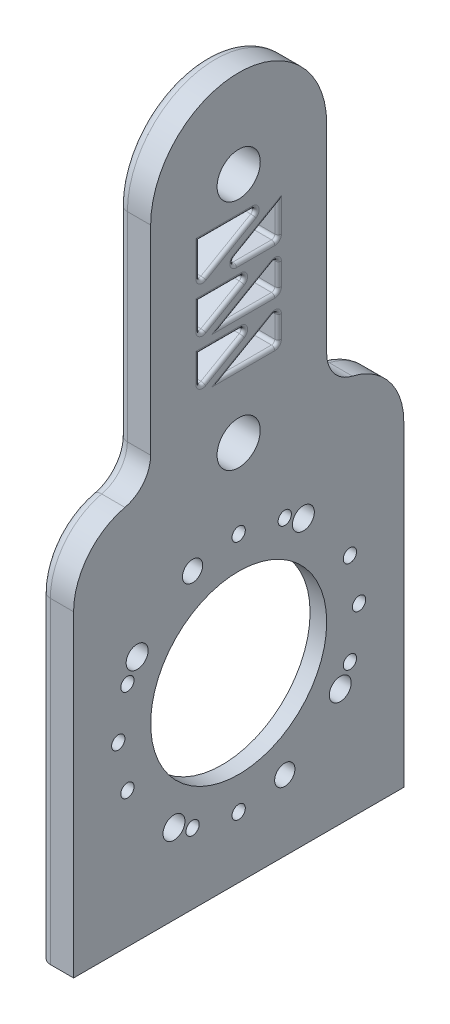
from build123d import *

# Parameters (mm, degrees)
SKETCH2_R           = 6.5
SKETCH2_R_2         = 2
SKETCH2_R_3         = 3.3
SKETCH2_R_4         = 3.05
SKETCH2_R_5         = 26.5
BOSS_EXTRUDE1_DEPTH = 5
BOSS_EXTRUDE2_START = -5
SKETCH2_5_R         = 6.5
SKETCH2_5_R_2       = 40.5
BOSS_EXTRUDE2_DEPTH = 5
CUT_EXTRUDE10_START = -10
CUT_EXTRUDE10_DEPTH = 10
FILLET1_R           = 10
FILLET2_R           = 20
FILLET3_R           = 1
FILLET4_R           = 3
CUT_EXTRUDE11_DEPTH = 10
FILLET5_R           = 1


with BuildPart() as part:
    # Sketch2 → Boss-Extrude1 (new body)
    with BuildSketch(Plane(origin=(0, 0, 0), x_dir=(0, 0, -1), z_dir=(1, 0, 0))):
        with BuildLine():
            Line((-49.7, 130), (-49.7, -54.7))
            Line((-49.7, -54.7), (49.7, -54.7))
            Line((49.7, -54.7), (49.7, 130))
            ThreePointArc((49.7, 130), (0, 179.7), (-49.7, 130))
        make_face()
        with Locations((-0.006451274, 60)):
            Circle(SKETCH2_R, mode=Mode.SUBTRACT)
        with Locations((0, 130)):
            Circle(SKETCH2_R, mode=Mode.SUBTRACT)
        with Locations((33.490633054, 13.872274423)):
            Circle(SKETCH2_R_2, mode=Mode.SUBTRACT)
        with Locations((-33.490633054, -13.872274423)):
            Circle(SKETCH2_R_2, mode=Mode.SUBTRACT)
        with Locations((-36.25, 0)):
            Circle(SKETCH2_R_2, mode=Mode.SUBTRACT)
        with Locations((-19.477110803, -30.572939911)):
            Circle(SKETCH2_R_3, mode=Mode.SUBTRACT)
        with Locations((-13.872274423, -33.490633054)):
            Circle(SKETCH2_R_2, mode=Mode.SUBTRACT)
        with Locations((-33.490633054, 13.872274423)):
            Circle(SKETCH2_R_2, mode=Mode.SUBTRACT)
        with Locations((-30.572939911, 19.477110803)):
            Circle(SKETCH2_R_3, mode=Mode.SUBTRACT)
        with Locations((-13.872274423, 33.490633054)):
            Circle(SKETCH2_R_4, mode=Mode.SUBTRACT)
        with Locations((0, 36.25)):
            Circle(SKETCH2_R_2, mode=Mode.SUBTRACT)
        with Locations((0, -36.25)):
            Circle(SKETCH2_R_2, mode=Mode.SUBTRACT)
        with Locations((13.872274423, -33.490633054)):
            Circle(SKETCH2_R_4, mode=Mode.SUBTRACT)
        Circle(SKETCH2_R_5, mode=Mode.SUBTRACT)
        with Locations((30.572939911, -19.477110803)):
            Circle(SKETCH2_R_3, mode=Mode.SUBTRACT)
        with Locations((33.490633054, -13.872274423)):
            Circle(SKETCH2_R_2, mode=Mode.SUBTRACT)
        with Locations((36.25, 0)):
            Circle(SKETCH2_R_2, mode=Mode.SUBTRACT)
        with Locations((19.477110803, 30.572939911)):
            Circle(SKETCH2_R_3, mode=Mode.SUBTRACT)
        with Locations((13.872274423, 33.490633054)):
            Circle(SKETCH2_R_2, mode=Mode.SUBTRACT)
    extrude(amount=BOSS_EXTRUDE1_DEPTH)

    # Sketch2<5> → Boss-Extrude2 (add)
    with BuildSketch(Plane(origin=(0, 0, 0), x_dir=(0, 0, -1), z_dir=(1, 0, 0)).offset(BOSS_EXTRUDE2_START)):
        with BuildLine():
            Line((-49.7, 130), (-49.7, 0))
            Line((-49.7, 0), (-49.7, -54.7))
            Line((-49.7, -54.7), (49.7, -54.7))
            Line((49.7, -54.7), (49.7, 30))
            Line((49.7, 30), (49.7, 130))
            ThreePointArc((49.7, 130), (0, 179.7), (-49.7, 130))
        make_face()
        with Locations((-0.006451274, 60)):
            Circle(SKETCH2_5_R, mode=Mode.SUBTRACT)
        Circle(SKETCH2_5_R_2, mode=Mode.SUBTRACT)
        with Locations((0, 130)):
            Circle(SKETCH2_5_R, mode=Mode.SUBTRACT)
    extrude(amount=BOSS_EXTRUDE2_DEPTH)

    # Sketch8 → Cut-Extrude10 (cut)
    with BuildSketch(Plane(origin=(5, 0, 0), x_dir=(0, 0, -1), z_dir=(1, 0, 0)).offset(CUT_EXTRUDE10_START)):
        with BuildLine():
            Line((26.5, 60), (49.7, 60))
            Line((49.7, 60), (49.7, 130))
            ThreePointArc((49.7, 130), (0, 179.7), (-49.7, 130))
            Line((-49.7, 130), (-49.7, 60.009159619))
            Line((-49.7, 60.009159619), (-26.512902097, 60.004885725))
            Line((-26.512902097, 60.004885725), (-26.49999955, 130.004884536))
            ThreePointArc((-26.49999955, 130.004884536), (0.002442268, 156.499999887), (26.5, 130))
            Line((26.5, 130), (26.5, 60))
        make_face()
    extrude(amount=CUT_EXTRUDE10_DEPTH, mode=Mode.SUBTRACT)

    # Fillet1
    fillet1_edges = [part.edges().sort_by_distance(p)[0] for p in [
        (0, 60.004885725, 26.512902097),
        (0, 60, -26.5),
    ]]
    fillet(fillet1_edges, radius=FILLET1_R)

    # Fillet2
    fillet2_edges = [part.edges().sort_by_distance(p)[0] for p in [
        (0, 60.009159619, 49.7),
        (0, 60, -49.7),
    ]]
    fillet(fillet2_edges, radius=FILLET2_R)

    # Fillet3
    fillet3_edges = [part.edges().sort_by_distance(p)[0] for p in [
        (-5, 0, 40.5),
    ]]
    fillet(fillet3_edges, radius=FILLET3_R)

    # Fillet4
    fillet4_edges = [part.edges().sort_by_distance(p)[0] for p in [
        (-5, -6.959585894, -49.7),
        (-5, 53.217333616, -45.363120166),
        (-5, 63.781747298, -28.668439917),
        (-5, 100, -26.5),
        (-5, -6.95493359, 49.7),
        (-5, 53.223673826, 45.365473438),
        (-5, 63.789236426, 28.678894964),
        (-5, 100.004885045, 26.505529213),
        (-5, 156.499999887, -0.002442268),
    ]]
    fillet(fillet4_edges, radius=FILLET4_R)

    # Sketch9 → Cut-Extrude11 (cut)
    with BuildSketch(Plane.ZY.offset(5)):
        Polygon((11.876221569, 118.683117188), (-7.876221569, 118.683117188), (11.876221569, 107.279038825), align=None)
        Polygon((4.412119954, 106.969637748), (-11.876221569, 116.373716111), (-11.876221569, 106.969637748), align=None)
        Polygon((11.876221569, 93.565559385), (11.876221569, 102.969637748), (-4.412119954, 102.969637748), align=None)
        Polygon((4.412119954, 93.256158309), (-11.876221569, 102.660236672), (-11.876221569, 93.256158309), align=None)
        Polygon((11.876221569, 79.852079945), (11.876221569, 89.256158309), (-4.412119954, 89.256158309), align=None)
        Polygon((4.412119954, 79.542678869), (-11.876221569, 88.946757232), (-11.876221569, 79.542678869), align=None)
    extrude(amount=-CUT_EXTRUDE11_DEPTH, mode=Mode.SUBTRACT)

    # Fillet5
    fillet5_edges = [part.edges().sort_by_distance(p)[0] for p in [
        (5, 118.683117188, 2),
        (-5, 118.683117188, 2),
        (5, 112.981078007, 11.876221569),
        (-5, 112.981078007, 11.876221569),
        (5, 111.67167693, -11.876221569),
        (-5, 111.67167693, -11.876221569),
        (5, 111.67167693, -3.732050808),
        (-5, 111.67167693, -3.732050808),
        (5, 102.969637748, 3.732050808),
        (-5, 102.969637748, 3.732050808),
        (5, 98.267598567, 11.876221569),
        (-5, 98.267598567, 11.876221569),
        (5, 89.256158309, 3.732050808),
        (-5, 89.256158309, 3.732050808),
        (5, 84.554119127, 11.876221569),
        (-5, 84.554119127, 11.876221569),
        (5, 97.95819749, -3.732050808),
        (-5, 97.95819749, -3.732050808),
        (5, 93.256158309, -3.732050808),
        (-5, 93.256158309, -3.732050808),
        (5, 84.24471805, -3.732050808),
        (-5, 84.24471805, -3.732050808),
        (5, 79.542678869, -3.732050808),
        (-5, 79.542678869, -3.732050808),
        (0, 118.683117188, -7.876221569),
        (5, 112.981078007, 2),
        (0, 107.279038825, 11.876221569),
        (-5, 112.981078007, 2),
        (0, 106.969637748, -11.876221569),
        (5, 106.969637748, -3.732050808),
        (0, 106.969637748, 4.412119954),
        (-5, 106.969637748, -3.732050808),
        (0, 102.969637748, -4.412119954),
        (5, 98.267598567, 3.732050808),
        (0, 93.565559385, 11.876221569),
        (-5, 98.267598567, 3.732050808),
        (0, 89.256158309, -4.412119954),
        (5, 84.554119127, 3.732050808),
        (0, 79.852079945, 11.876221569),
        (-5, 84.554119127, 3.732050808),
        (0, 102.660236672, -11.876221569),
        (5, 97.95819749, -11.876221569),
        (0, 93.256158309, -11.876221569),
        (-5, 97.95819749, -11.876221569),
        (0, 88.946757232, -11.876221569),
        (5, 84.24471805, -11.876221569),
        (0, 79.542678869, -11.876221569),
        (-5, 84.24471805, -11.876221569),
    ]]
    fillet(fillet5_edges, radius=FILLET5_R)


solid = part.part
